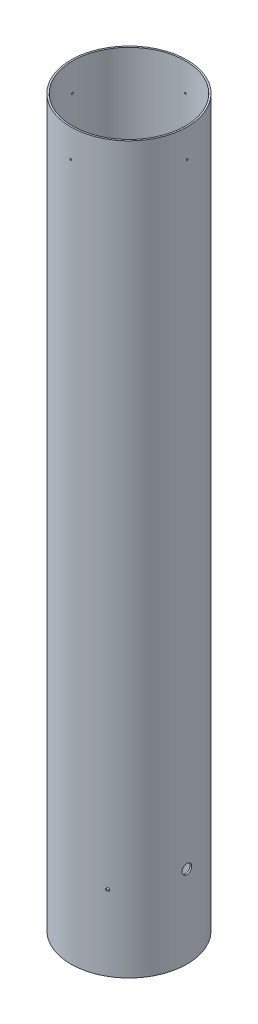
from build123d import *

# Parameters (mm, degrees)
SKETCH1_R           = 78.359
SKETCH1_R_2         = 76.1746
BOSS_EXTRUDE1_DEPTH = 977.9
SKETCH2_R           = 1.0922
CUT_EXTRUDE1_DEPTH  = 985.158867136
CIRPATTERN1_COUNT   = 4
CIRPATTERN2_COUNT   = 3


with BuildPart() as part:
    # Sketch1 → Boss-Extrude1 (new body)
    with BuildSketch(Plane(origin=(0, 0, 0), x_dir=(1, 0, 0), z_dir=(0, 1, 0))):
        Circle(SKETCH1_R)
        Circle(SKETCH1_R_2, mode=Mode.SUBTRACT)
    extrude(amount=BOSS_EXTRUDE1_DEPTH)

    # Sketch2 → Cut-Extrude1 (cut, through all)
    with BuildSketch(Plane(origin=(0, 0, 0), x_dir=(0, 0, -1), z_dir=(1, 0, 0))):
        with Locations((0, 939.8)):
            Circle(SKETCH2_R)
    cut_extrude1 = extrude(amount=-CUT_EXTRUDE1_DEPTH, mode=Mode.SUBTRACT)

    # CirPattern1: Cut-Extrude1 ×4 about axis
    cirpattern1_axis = Axis((0, 977.9, 0), (0, 1, 0))
    for i in range(1, CIRPATTERN1_COUNT):
        add(cut_extrude1.rotate(cirpattern1_axis, i * 360 / CIRPATTERN1_COUNT), mode=Mode.SUBTRACT)

    # Sketch4 → 1/2 Clearance Hole1 (revolve, cut)
    with BuildSketch(Plane.ZX.offset(111.125)):
        Polygon((0, 0), (0, 92.834507437), (6.54812, 88.9), (6.54812, 0), align=None)
    revolve(axis=Axis((-6.35, 111.125, 0), (1, 0, 0)), mode=Mode.SUBTRACT)

    # Sketch6 → Ø4.0 (4) Diameter Hole1 (revolve, cut)
    with BuildSketch(Plane(origin=(0, 101.6, 0), x_dir=(0, 0, -1), z_dir=(0, 1, 0))):
        Polygon((0, 0), (0, 90.101721238), (2, 88.9), (2, 0), align=None)
    f_4_0_4_diameter_hole1 = revolve(axis=Axis((6.35, 101.6, 0), (-1, 0, 0)), mode=Mode.SUBTRACT)

    # CirPattern2: Ø4.0 (4) Diameter Hole1 ×3 about axis
    cirpattern2_axis = Axis((0, 0, 0), (0, 1, 0))
    for i in range(1, CIRPATTERN2_COUNT):
        add(f_4_0_4_diameter_hole1.rotate(cirpattern2_axis, i * 360 / CIRPATTERN2_COUNT), mode=Mode.SUBTRACT)


solid = part.part
